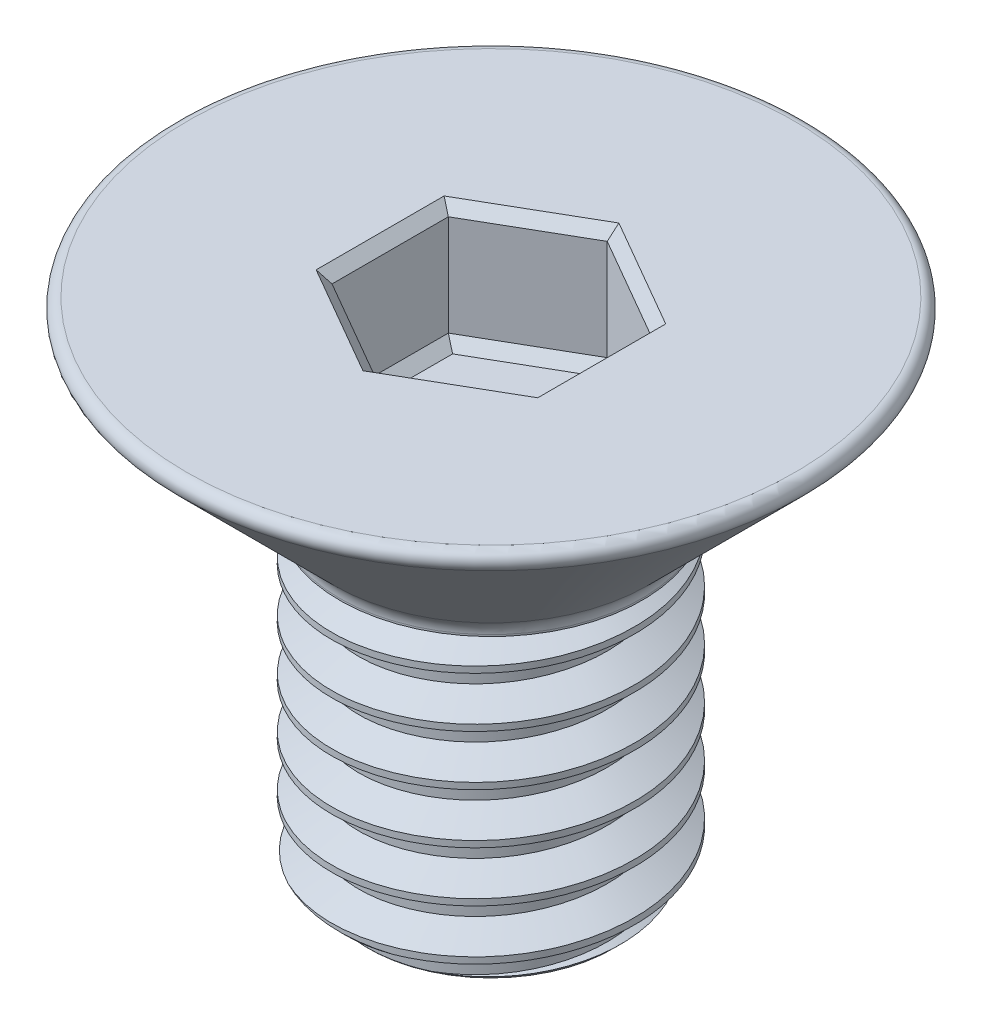
from build123d import *

# Parameters (mm, degrees)
SKETCH1_R           = 1.5
BOSS_EXTRUDE1_DEPTH = 3.14
THREAD1_PITCH       = 0.5
SKETCH5_R           = 1.5
BOSS_EXTRUDE2_DEPTH = 0.1
SKETCH6_R           = 1.5
BOSS_EXTRUDE3_DEPTH = 1.76
BOSS_EXTRUDE3_DRAFT = -45
FILLET1_R           = 0.1
FILLET2_R           = 0.2
CUT_EXTRUDE1_DEPTH  = 1.1
CHAMFER1_SIZE       = 0.1
CUT_EXTRUDE2_DEPTH  = 0.1
CUT_EXTRUDE2_DRAFT  = -45


with BuildPart() as part:
    # Sketch1 → Boss-Extrude1 (new body)
    with BuildSketch(Plane(origin=(0, 0, 0), x_dir=(1, 0, 0), z_dir=(0, 1, 0))):
        with Locations(Location((0, 0, 0), (0, 0, 270))):
            Circle(SKETCH1_R)
    extrude(amount=BOSS_EXTRUDE1_DEPTH)

    # Thread1: the profile of Thread Profile1 profile screwed along a right-hand helix of 8.28 turns, 6 arcs to a turn; built about Z, then put on its axis
    thread1_z = Axis((0, 0, 0), (0, 0, 1))
    thread1_corners = [(1.5003, 0, -0.000173205), (1.5003, 0, 0.437673204), (1.229367063, 0, 0.281249999), (1.229367063, 0, 0.156249999)]
    with BuildLine(mode=Mode.PRIVATE) as thread1_profile:
        Line(thread1_corners[0], thread1_corners[1])
        Line(thread1_corners[1], thread1_corners[2])
        Line(thread1_corners[2], thread1_corners[3])
        Line(thread1_corners[3], thread1_corners[0])
    thread1_cap = Face(thread1_profile.wire())
    thread1_turn_angles = [0, 30, 60, 90, 120, 150, 180, 210, 240, 270, 300, 330, 360]
    thread1_turn_weights = [1, 0.8660254037844387, 1, 0.8660254037844387, 1, 0.8660254037844387, 1, 0.8660254037844387, 1, 0.8660254037844387, 1, 0.8660254037844387, 1]
    thread1_turn_rails = [Edge.make_bspline([Vector(p[0], p[1], 0).rotate(thread1_z, thread1_turn_angles[k]) / thread1_turn_weights[k] + Vector(0, 0, p[2] + THREAD1_PITCH * thread1_turn_angles[k] / 360) for k in range(13)], [0, 0, 0, 1, 1, 2, 2, 3, 3, 4, 4, 5, 5, 6, 6, 6], 2, thread1_turn_weights) for p in thread1_corners]
    thread1_turn_sides = [Face.make_surface_from_curves(thread1_turn_rails[p[0]], thread1_turn_rails[p[1]]) for p in [(0, 1), (1, 2), (2, 3), (3, 0)]]
    thread1_last_angles = [2880, 2910, 2940, 2960.4, 2980.8]
    thread1_last_weights = [1, 0.8660254037844387, 1, 0.9372819894918923, 1]
    thread1_last_rails = [Edge.make_bspline([Vector(p[0], p[1], 0).rotate(thread1_z, thread1_last_angles[k]) / thread1_last_weights[k] + Vector(0, 0, p[2] + THREAD1_PITCH * thread1_last_angles[k] / 360) for k in range(5)], [0, 0, 0, 1, 1, 2, 2, 2], 2, thread1_last_weights) for p in thread1_corners]
    thread1_last_sides = [Face.make_surface_from_curves(thread1_last_rails[p[0]], thread1_last_rails[p[1]]) for p in [(0, 1), (1, 2), (2, 3), (3, 0)]]
    thread1 = Plane(origin=(0, 4.14, 0), x_dir=(-1, 0, 0), z_dir=(0, -1, 0)) * Solid(Shell([*[p.moved(Location((0, 0, THREAD1_PITCH * i))) for i in range(8) for p in thread1_turn_sides], *thread1_last_sides, thread1_cap, thread1_cap.rotate(thread1_z, 2980.8).moved(Location((0, 0, THREAD1_PITCH * 2980.8 / 360)))]))
    add(thread1, mode=Mode.SUBTRACT)

    # Sketch5 → Boss-Extrude2 (add)
    with BuildSketch(Plane(origin=(0, 3.14, 0), x_dir=(1, 0, 0), z_dir=(0, 1, 0))):
        with Locations(Location((0, 0, 0), (0, 0, 79.630240195))):
            Circle(SKETCH5_R)
    extrude(amount=BOSS_EXTRUDE2_DEPTH)


with BuildPart() as boss_extrude3_tool:
    # Sketch6 → Boss-Extrude3 (with draft: the straight prism first)
    with BuildSketch(Plane(origin=(0, 3.24, 0), x_dir=(1, 0, 0), z_dir=(0, 1, 0))):
        with Locations(Location((0, 0, 0), (0, 0, 79.630240195))):
            Circle(SKETCH6_R)
    extrude(amount=BOSS_EXTRUDE3_DEPTH)
    # Boss-Extrude3: the draft: its side faces are tilted about the plane it starts from
    boss_extrude3_sides = [boss_extrude3_tool.faces().sort_by_distance(p)[0] for p in [
        (-0.27, 4.12, 1.475499915),
    ]]
    draft(boss_extrude3_sides, Plane(origin=(0, 3.24, 0), x_dir=(1, 0, 0), z_dir=(0, 1, 0)), BOSS_EXTRUDE3_DRAFT)


with BuildPart() as part_1:
    add(part.part)

    # Boss-Extrude3: add boss_extrude3_tool
    add(boss_extrude3_tool.part)

    # Sketch7 → Cut-Revolve1 (revolve, cut)
    with BuildSketch(Plane.XY, mode=Mode.PRIVATE) as cut_revolve1_sk:
        Polygon((1.51, 0), (1.51, 0.3), (1.21, 0), align=None)
    revolve(cut_revolve1_sk.sketch.rotate(Axis((0, 0, 0), (0, 1, 0)), 135.522486844), axis=Axis((0, 0, 0), (0, 1, 0)), mode=Mode.SUBTRACT)

    # Fillet1
    fillet1_edges = [part_1.edges().sort_by_distance(p)[0] for p in [
        (-0.5868, 5, 3.206753149),
    ]]
    fillet(fillet1_edges, radius=FILLET1_R)

    # Fillet2
    fillet2_edges = [part_1.edges().sort_by_distance(p)[0] for p in [
        (-0.27, 3.24, 1.475499915),
    ]]
    fillet(fillet2_edges, radius=FILLET2_R)

    # Sketch8 → Cut-Extrude1 (cut)
    with BuildSketch(Plane(origin=(0, 5, 0), x_dir=(1, 0, 0), z_dir=(0, 1, 0))):
        Polygon((0, 1.154700538), (-1, 0.577350269), (-1, -0.577350269), (0, -1.154700538), (1, -0.577350269), (1, 0.577350269), align=None)
    extrude(amount=-CUT_EXTRUDE1_DEPTH, mode=Mode.SUBTRACT)

    # Chamfer1
    chamfer1_edges = [part_1.edges().sort_by_distance(p)[0] for p in [
        (0.5, 5, -0.866025404),
        (-0.5, 5, -0.866025404),
        (-1, 5, 0),
        (-0.5, 5, 0.866025404),
        (0.5, 5, 0.866025404),
        (1, 5, 0),
    ]]
    chamfer(chamfer1_edges, length=CHAMFER1_SIZE)


with BuildPart() as cut_extrude2_tool:
    # Sketch9 → Cut-Extrude2 (with draft: the straight prism first)
    with BuildSketch(Plane(origin=(0, 3.9, 0), x_dir=(1, 0, 0), z_dir=(0, 1, 0))):
        Polygon((0, 1.154700538), (-1, 0.577350269), (-1, -0.577350269), (0, -1.154700538), (1, -0.577350269), (1, 0.577350269), align=None)
    extrude(amount=-CUT_EXTRUDE2_DEPTH)
    # Cut-Extrude2: the draft: its side faces are tilted about the plane it starts from
    cut_extrude2_sides = [cut_extrude2_tool.faces().sort_by_distance(p)[0] for p in [
        (-0.5, 3.85, -0.866025404),
        (-1, 3.85, 0),
        (-0.5, 3.85, 0.866025404),
        (0.5, 3.85, 0.866025404),
        (1, 3.85, 0),
        (0.5, 3.85, -0.866025404),
    ]]
    draft(cut_extrude2_sides, Plane(origin=(0, 3.9, 0), x_dir=(1, 0, 0), z_dir=(0, 1, 0)), CUT_EXTRUDE2_DRAFT)


with BuildPart() as part_2:
    add(part_1.part)

    # Cut-Extrude2: cut by cut_extrude2_tool
    add(cut_extrude2_tool.part, mode=Mode.SUBTRACT)


solid = part_2.part
